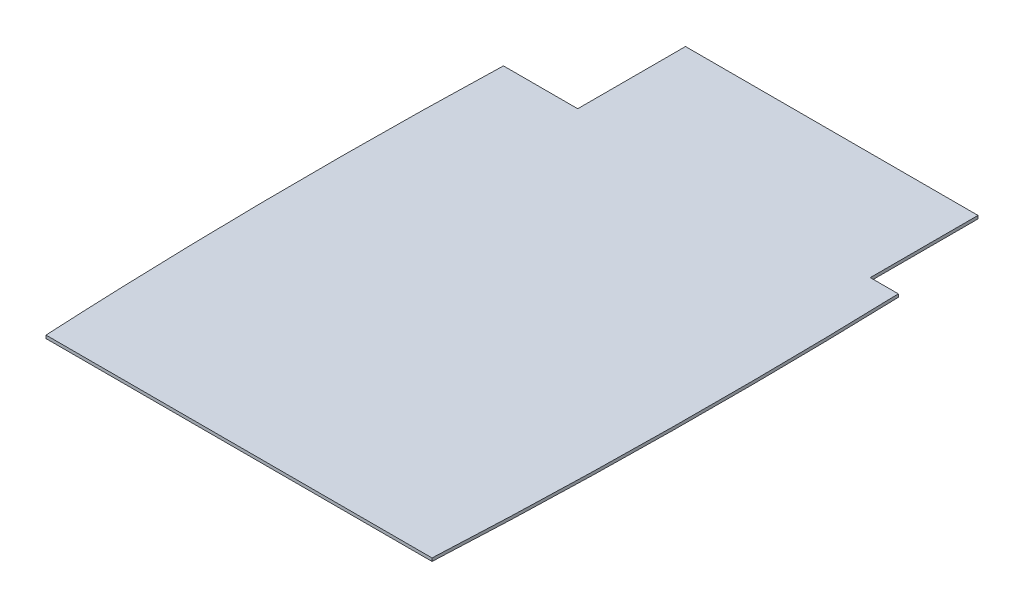
from build123d import *

# Parameters (mm, degrees)
EXTRUDE_1_DEPTH     = 0.5
SKETCH_3_W          = 25
SKETCH_3_H          = 35
CUT_EXTRUDE_1_DEPTH = 114.058613257
SKETCH_4_W          = 10
SKETCH_4_H          = 35
CUT_EXTRUDE_2_DEPTH = 114.058613257


with BuildPart() as part:
    # ｽｹｯﾁ1 → ﾎﾞｽ - 押し出し1 (new, symmetric)
    with BuildSketch(Plane(origin=(0, 0, 0), x_dir=(1, 0, 0), z_dir=(0, 1, 0))):
        with BuildLine():
            Line((62.68888804, 92.5), (-62.68888804, 92.5))
            add(Edge.make_bspline(
                [(-62.68888804, 92.5), (-67.396314277, 0), (-62.68888804, -92.5)],
                knots=[4.444925752, 4.444925752, 4.444925752, 4.979852209, 4.979852209, 4.979852209], degree=2, weights=[1, 0.964444431, 1]))
            Line((-62.68888804, -92.5), (62.68888804, -92.5))
            add(Edge.make_bspline(
                [(62.68888804, -92.5), (67.396314277, 0), (62.68888804, 92.5)],
                knots=[1.303333099, 1.303333099, 1.303333099, 1.838259555, 1.838259555, 1.838259555], degree=2, weights=[1, 0.964444431, 1]))
        make_face()
    extrude(amount=EXTRUDE_1_DEPTH, both=True)

    # ｽｹｯﾁ3 → ｶｯﾄ - 押し出し1 (cut, through all)
    with BuildSketch(Plane(origin=(0, 0.5, 0), x_dir=(1, 0, 0), z_dir=(0, 1, 0))):
        with Locations((-52.5, 75)):
            Rectangle(SKETCH_3_W, SKETCH_3_H)
    extrude(amount=-CUT_EXTRUDE_1_DEPTH, mode=Mode.SUBTRACT)

    # ｽｹｯﾁ4 → ｶｯﾄ - 押し出し2 (cut, through all)
    with BuildSketch(Plane(origin=(0, 0.5, 0), x_dir=(1, 0, 0), z_dir=(0, 1, 0))):
        with Locations((60, 75)):
            Rectangle(SKETCH_4_W, SKETCH_4_H)
    extrude(amount=-CUT_EXTRUDE_2_DEPTH, mode=Mode.SUBTRACT)


solid = part.part
